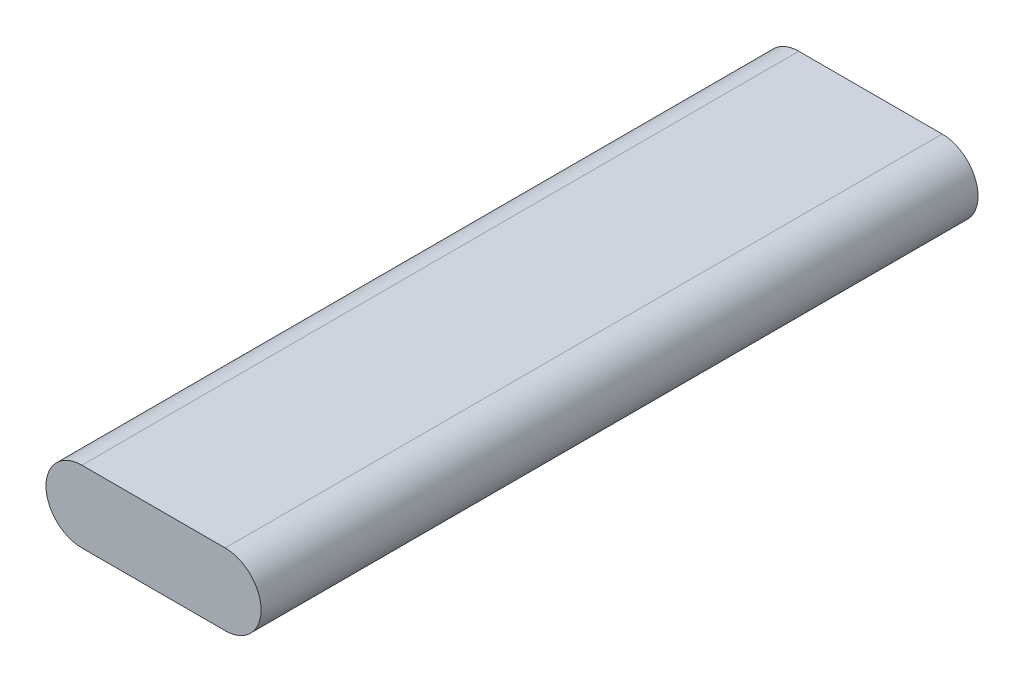
from build123d import *

# Parameters (mm, degrees)
SHEET_START           = -50
SHEET_EXTRUDE_1_DEPTH = 100


# Read off the part's stored shape, not the designer's step: 曲面-拉伸1
with BuildPart() as part:
    # Sheet Extrude 1 outline → Sheet Extrude 1 (new body)
    with BuildSketch(Plane.XY.offset(SHEET_START)):
        with BuildLine():
            ThreePointArc((-10, 5), (-15, 0), (-10, -5))
            Line((-10, -5), (10, -5))
            ThreePointArc((10, -5), (15, 0), (10, 5))
            Line((10, 5), (-10, 5))
        make_face()
    extrude(amount=SHEET_EXTRUDE_1_DEPTH)


solid = part.part
